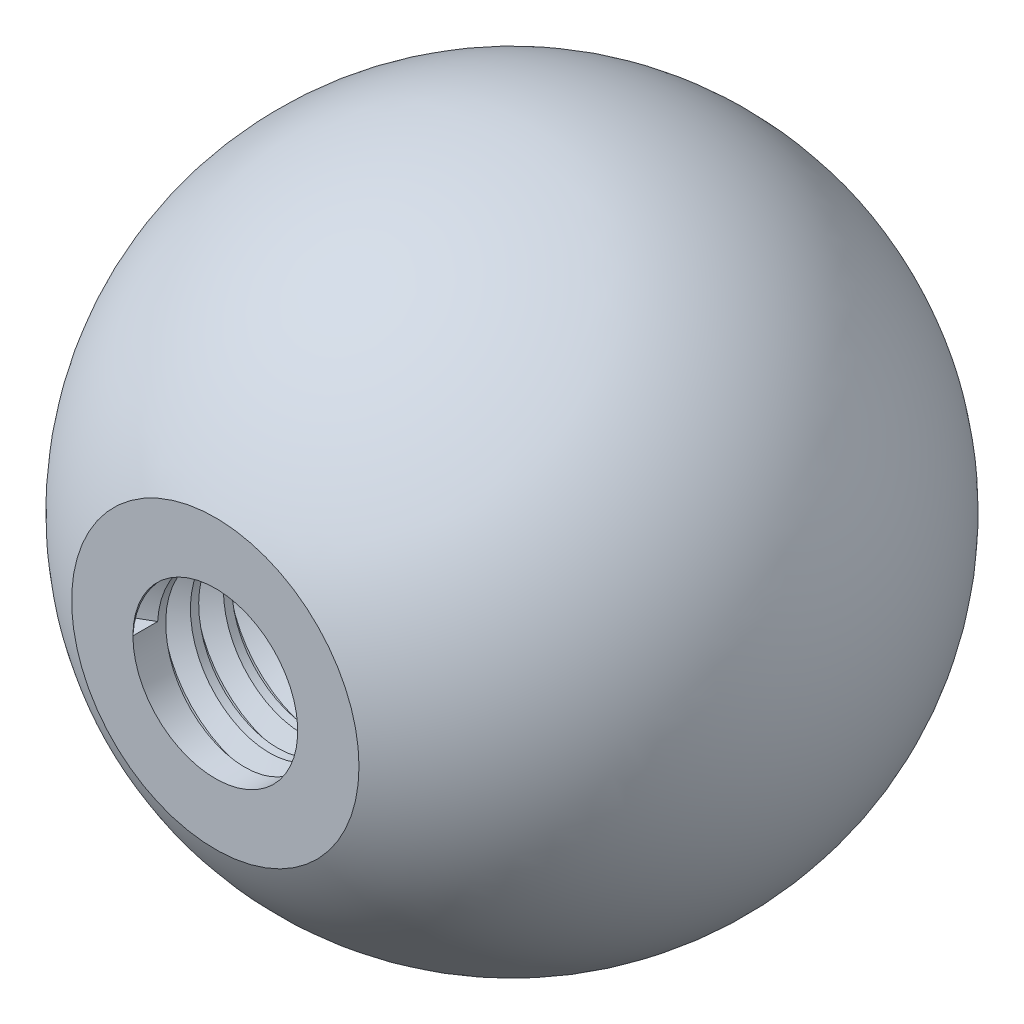
from build123d import *

# Parameters (mm, degrees)
SKETCH2_R                       = 12.7
CUT_EXTRUDE1_DEPTH              = 1.27
F_1_4_0_25_DIAMETER_HOLE1_D     = 6.35
F_1_4_0_25_DIAMETER_HOLE1_DEPTH = 10.16
F_1_4_0_25_DIAMETER_HOLE1_TIP   = 1.907732465
THREAD2_PITCH                   = 1.27


with BuildPart() as part:
    # Sketch1 → Revolve1 (revolve)
    with BuildSketch(Plane.XY):
        with BuildLine():
            Line((0, 0), (-12.7, 0))
            ThreePointArc((-12.7, 0), (0, 12.7), (12.7, 0))
            Line((12.7, 0), (0, 0))
        make_face()
    revolve(axis=Axis((0, 0, 0), (-1, 0, 0)))

    # Sketch2 → Cut-Extrude1 (cut)
    with BuildSketch(Plane.XY.offset(12.7)):
        Circle(SKETCH2_R)
    extrude(amount=-CUT_EXTRUDE1_DEPTH, mode=Mode.SUBTRACT)

    # 1/4 (0.25) Diameter Hole1
    with Locations(Plane.XY.offset(11.43)):
        with Locations((0, 0)):
            Hole(F_1_4_0_25_DIAMETER_HOLE1_D / 2, depth=F_1_4_0_25_DIAMETER_HOLE1_DEPTH)
            with Locations((0, 0, -(F_1_4_0_25_DIAMETER_HOLE1_DEPTH + F_1_4_0_25_DIAMETER_HOLE1_TIP / 2))):  # 118° drill point
                Cone(0, F_1_4_0_25_DIAMETER_HOLE1_D / 2, F_1_4_0_25_DIAMETER_HOLE1_TIP, mode=Mode.SUBTRACT)

    # Thread2: the profile of Thread Profile2 profile screwed along a right-hand helix of 8 turns, 8 arcs to a turn; built about Z, then put on its axis
    thread2_z = Axis((0, 0, 0), (0, 0, 1))
    thread2_corners = [(3.1747, 0, -0.000173205), (3.862407661, 0, 0.396874998), (3.862407661, 0, 0.555624998), (3.1747, 0, 0.952673202)]
    with BuildLine(mode=Mode.PRIVATE) as thread2_profile:
        Line(thread2_corners[0], thread2_corners[1])
        Line(thread2_corners[1], thread2_corners[2])
        Line(thread2_corners[2], thread2_corners[3])
        Line(thread2_corners[3], thread2_corners[0])
    thread2_cap = Face(thread2_profile.wire())
    thread2_turn_angles = [0, 22.5, 45, 67.5, 90, 112.5, 135, 157.5, 180, 202.5, 225, 247.5, 270, 292.5, 315, 337.5, 360]
    thread2_turn_weights = [1, 0.9238795325112867, 1, 0.9238795325112867, 1, 0.9238795325112867, 1, 0.9238795325112867, 1, 0.9238795325112867, 1, 0.9238795325112867, 1, 0.9238795325112867, 1, 0.9238795325112867, 1]
    thread2_turn_rails = [Edge.make_bspline([Vector(p[0], p[1], 0).rotate(thread2_z, thread2_turn_angles[k]) / thread2_turn_weights[k] + Vector(0, 0, p[2] + THREAD2_PITCH * thread2_turn_angles[k] / 360) for k in range(17)], [0, 0, 0, 1, 1, 2, 2, 3, 3, 4, 4, 5, 5, 6, 6, 7, 7, 8, 8, 8], 2, thread2_turn_weights) for p in thread2_corners]
    thread2_turn_sides = [Face.make_surface_from_curves(thread2_turn_rails[p[0]], thread2_turn_rails[p[1]]) for p in [(0, 1), (1, 2), (2, 3), (3, 0)]]
    thread2 = Plane(origin=(0, 0, 11.43), x_dir=(-1, 0, 0), z_dir=(0, 0, -1)) * Solid(Shell([*[p.moved(Location((0, 0, THREAD2_PITCH * i))) for i in range(8) for p in thread2_turn_sides], thread2_cap, thread2_cap.rotate(thread2_z, 2880).moved(Location((0, 0, THREAD2_PITCH * 2880 / 360)))]))
    add(thread2, mode=Mode.SUBTRACT)


solid = part.part
